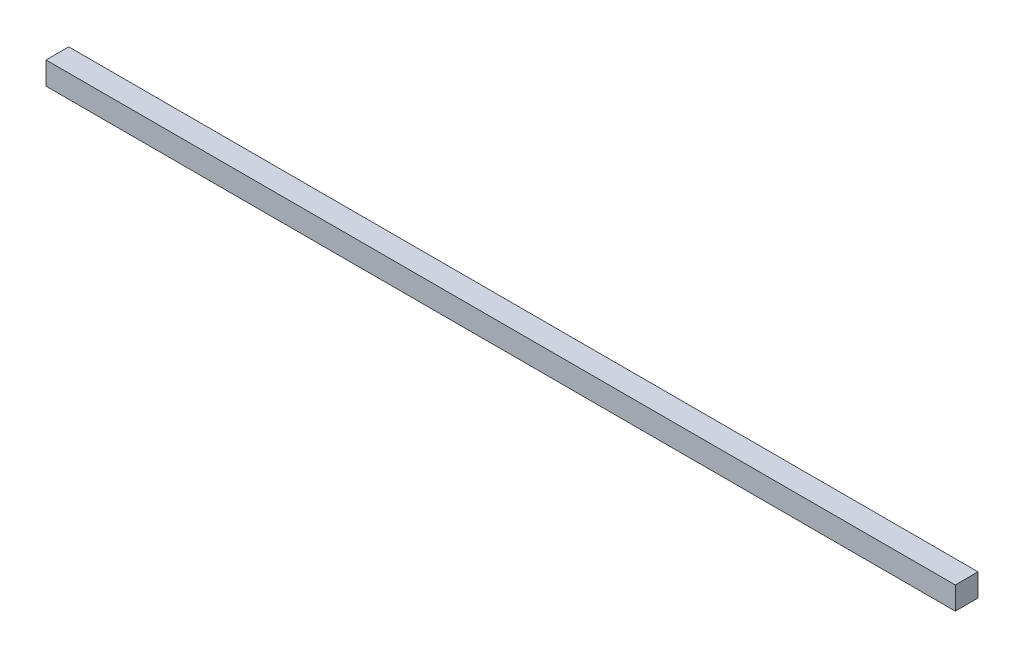
from build123d import *

# Parameters (mm, degrees)
SKETCH1_W           = 400
SKETCH1_H           = 10
BOSS_EXTRUDE1_DEPTH = 5


with BuildPart() as part:
    # Sketch1 → Boss-Extrude1 (new, symmetric)
    with BuildSketch(Plane.XY):
        Rectangle(SKETCH1_W, SKETCH1_H)
    extrude(amount=BOSS_EXTRUDE1_DEPTH, both=True)


solid = part.part
